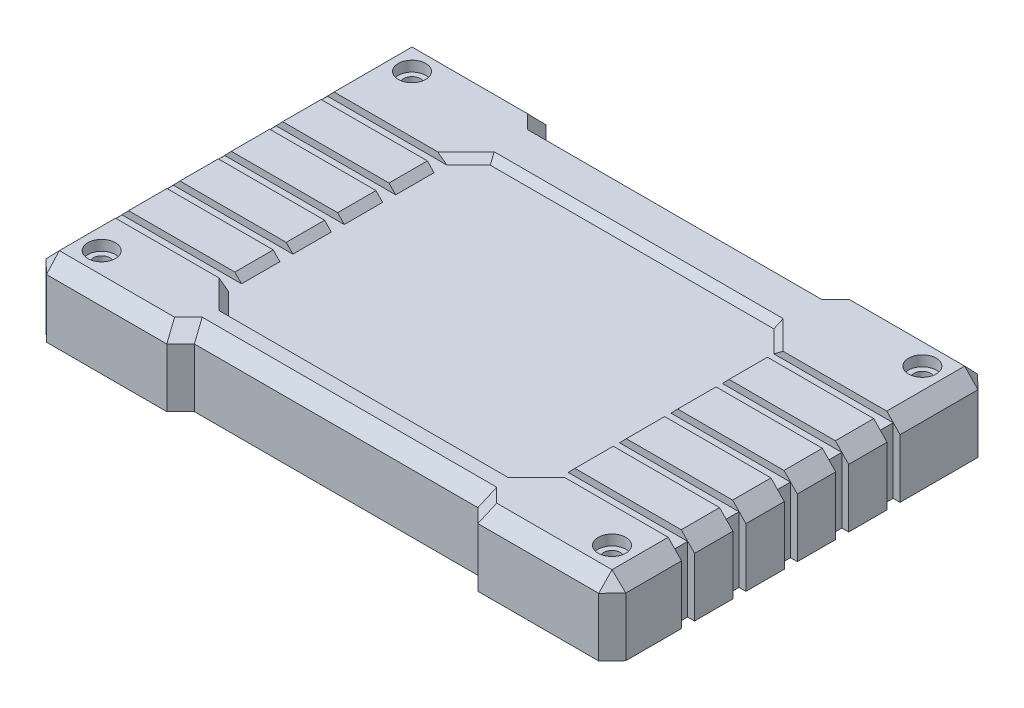
from build123d import *
from OCP.BRepFilletAPI import BRepFilletAPI_MakeChamfer

# Parameters (mm, degrees)
SKETCH_1_W          = 74
SKETCH_1_H          = 45
EXTRUDE_1_DEPTH     = 2
SKETCH_2_W          = 45
SKETCH_2_H          = 9.5
EXTRUDE_2_DEPTH     = 4
SKETCH_3_W          = 45
SKETCH_3_H          = 9.5
EXTRUDE_3_DEPTH     = 4
SKETCH_4_W          = 82
SKETCH_4_H          = 9.5
EXTRUDE_4_DEPTH     = 3
SKETCH_5_W          = 82
SKETCH_5_H          = 9.5
EXTRUDE_5_DEPTH     = 3
EXTRUDE_11_DEPTH    = 7.5
SKETCH_15_R         = 1.2
CUT_EXTRUDE_1_DEPTH = 50.208739061
SKETCH_16_R         = 2
SKETCH_16_R_2       = 0.9
EXTRUDE_12_DEPTH    = 4
SKETCH_17_W         = 5.562046036
SKETCH_17_H         = 9.5
SKETCH_17_W_2       = 11.231023018
SKETCH_17_W_3       = 8.081023018
EXTRUDE_13_DEPTH    = 1
SKETCH_18_W         = 5.562046036
SKETCH_18_H         = 9.5
SKETCH_18_W_2       = 11.231023018
SKETCH_18_W_3       = 8.081023018
EXTRUDE_14_DEPTH    = 1
EXTRUDE_15_DEPTH    = 9.5
SKETCH_20_W         = 18.311590736
SKETCH_20_H         = 5.562046036
EXTRUDE_16_DEPTH    = 1
CHAMFER_1_SIZE      = 2
CHAMFER_1_SIZE2     = 1.93137755
CHAMFER_2_SIZE      = 0.965688775
CHAMFER_2_SIZE_2    = 1
SKETCH_22_R         = 1.6
CUT_EXTRUDE_3_DEPTH = 5
CUT_EXTRUDE_4_REACH = 85.985
SKETCH_25_R         = 1.2
CUT_EXTRUDE_5_DEPTH = 52.093052365
SKETCH_26_R         = 2
CUT_EXTRUDE_6_DEPTH = 1.5
CUT_EXTRUDE_7_DEPTH = 2.5
CHAMFER_3_SIZE      = 1


with BuildPart() as part:
    # Эскиз1 → Бобышка-Вытянуть1 (new body)
    with BuildSketch(Plane(origin=(0, 0, 0), x_dir=(1, 0, 0), z_dir=(0, 1, 0))):
        Rectangle(SKETCH_1_W, SKETCH_1_H)
    extrude(amount=EXTRUDE_1_DEPTH)

    # Эскиз2 → Бобышка-Вытянуть2 (add)
    with BuildSketch(Plane.ZY.offset(37)):
        with Locations((0, -2.75)):
            Rectangle(SKETCH_2_W, SKETCH_2_H)
    extrude(amount=EXTRUDE_2_DEPTH)

    # Эскиз3 → Бобышка-Вытянуть3 (add)
    with BuildSketch(Plane(origin=(37, 0, 0), x_dir=(0, 0, -1), z_dir=(1, 0, 0))):
        with Locations((0, -2.75)):
            Rectangle(SKETCH_3_W, SKETCH_3_H)
    extrude(amount=EXTRUDE_3_DEPTH)

    # Эскиз4 → Бобышка-Вытянуть4 (add)
    with BuildSketch(Plane(origin=(0, 0, -22.5), x_dir=(-1, 0, 0), z_dir=(0, 0, -1))):
        with Locations((0, -2.75)):
            Rectangle(SKETCH_4_W, SKETCH_4_H)
    extrude(amount=EXTRUDE_4_DEPTH)

    # Эскиз5 → Бобышка-Вытянуть5 (add)
    with BuildSketch(Plane.XY.offset(22.5)):
        with Locations((0, -2.75)):
            Rectangle(SKETCH_5_W, SKETCH_5_H)
    extrude(amount=EXTRUDE_5_DEPTH)

    # Эскиз13 → Бобышка-Вытянуть11 (add)
    with BuildSketch(Plane.XZ):
        with BuildLine():
            Line((-37, -19.5), (-37, -22.5))
            Line((-37, -22.5), (-34, -22.5))
            ThreePointArc((-34, -22.5), (-34.878679656, -20.378679656), (-37, -19.5))
        make_face()
        with BuildLine():
            Line((-37, 22.5), (-34, 22.5))
            ThreePointArc((-34, 22.5), (-34.878679656, 20.378679656), (-37, 19.5))
            Line((-37, 19.5), (-37, 22.5))
        make_face()
        with BuildLine():
            Line((37, -22.5), (34, -22.5))
            ThreePointArc((34, -22.5), (34.878679656, -20.378679656), (37, -19.5))
            Line((37, -19.5), (37, -22.5))
        make_face()
        with BuildLine():
            Line((37, 22.5), (34, 22.5))
            ThreePointArc((34, 22.5), (34.878679656, 20.378679656), (37, 19.5))
            Line((37, 19.5), (37, 22.5))
        make_face()
    extrude(amount=EXTRUDE_11_DEPTH)

    # Эскиз15 → Вырез-Вытянуть1 (cut, through all)
    with BuildSketch(Plane.XZ.offset(7.5)):
        with Locations(Location((-37, -22.5, 0), (0, 0, 270))):
            Circle(SKETCH_15_R)
        with Locations(Location((-37, 22.5, 0), (0, 0, 270))):
            Circle(SKETCH_15_R)
        with Locations(Location((37, -22.5, 0), (0, 0, 90))):
            Circle(SKETCH_15_R)
        with Locations(Location((37, 22.5, 0), (0, 0, 90))):
            Circle(SKETCH_15_R)
    extrude(amount=-CUT_EXTRUDE_1_DEPTH, mode=Mode.SUBTRACT)

    # Эскиз16 → Бобышка-Вытянуть12 (add)
    # profile 1 of 5: a face of its own
    with BuildSketch(Plane.XZ):
        with Locations(Location((-33, 18.5, 0), (0, 0, 270))):
            Circle(SKETCH_16_R)
        with Locations(Location((-33, 18.5, 0), (0, 0, 270))):
            Circle(SKETCH_16_R_2, mode=Mode.SUBTRACT)
    # profile 2 of 5: a face of its own
    with BuildSketch(Plane.XZ):
        with Locations(Location((33, 18.5, 0), (0, 0, 270))):
            Circle(SKETCH_16_R)
        with Locations(Location((33, 18.5, 0), (0, 0, 270))):
            Circle(SKETCH_16_R_2, mode=Mode.SUBTRACT)
    # profile 3 of 5: a face of its own
    with BuildSketch(Plane.XZ):
        with Locations(Location((33, -15, 0), (0, 0, 270))):
            Circle(SKETCH_16_R)
        with Locations(Location((33, -15, 0), (0, 0, 270))):
            Circle(SKETCH_16_R_2, mode=Mode.SUBTRACT)
    # profile 4 of 5: a face of its own
    with BuildSketch(Plane.XZ):
        with Locations(Location((7, -15, 0), (0, 0, 270))):
            Circle(SKETCH_16_R)
        with Locations(Location((7, -15, 0), (0, 0, 270))):
            Circle(SKETCH_16_R_2, mode=Mode.SUBTRACT)
    # profile 5 of 5: a face of its own
    with BuildSketch(Plane.XZ):
        with Locations(Location((-33, -1.5, 0), (0, 0, 270))):
            Circle(SKETCH_16_R)
        with Locations(Location((-33, -1.5, 0), (0, 0, 270))):
            Circle(SKETCH_16_R_2, mode=Mode.SUBTRACT)
    extrude(amount=EXTRUDE_12_DEPTH)

    # Эскиз17 → Бобышка-Вытянуть13 (add)
    with BuildSketch(Plane.ZY.offset(41)):
        with Locations((12.75, -2.75)):
            Rectangle(SKETCH_17_W, SKETCH_17_H)
        with Locations((-19.884488491, -2.75)):
            Rectangle(SKETCH_17_W_2, SKETCH_17_H)
        with Locations((5.3, -2.75)):
            Rectangle(SKETCH_17_W, SKETCH_17_H)
        with Locations((-2.15, -2.75)):
            Rectangle(SKETCH_17_W, SKETCH_17_H)
        with Locations((-9.6, -2.75)):
            Rectangle(SKETCH_17_W, SKETCH_17_H)
        with Locations((21.459488491, -2.75)):
            Rectangle(SKETCH_17_W_3, SKETCH_17_H)
    extrude(amount=EXTRUDE_13_DEPTH)

    # Эскиз18 → Бобышка-Вытянуть14 (add)
    with BuildSketch(Plane(origin=(41, 0, 0), x_dir=(0, 0, -1), z_dir=(1, 0, 0))):
        with Locations((-12.75, -2.75)):
            Rectangle(SKETCH_18_W, SKETCH_18_H)
        with Locations((19.884488491, -2.75)):
            Rectangle(SKETCH_18_W_2, SKETCH_18_H)
        with Locations((-5.3, -2.75)):
            Rectangle(SKETCH_18_W, SKETCH_18_H)
        with Locations((2.15, -2.75)):
            Rectangle(SKETCH_18_W, SKETCH_18_H)
        with Locations((9.6, -2.75)):
            Rectangle(SKETCH_18_W, SKETCH_18_H)
        with Locations((-21.459488491, -2.75)):
            Rectangle(SKETCH_18_W_3, SKETCH_18_H)
    extrude(amount=EXTRUDE_14_DEPTH)

    # Эскиз19 → Бобышка-Вытянуть15 (add)
    with BuildSketch(Plane(origin=(0, 2, 0), x_dir=(1, 0, 0), z_dir=(0, 1, 0))):
        Polygon((-42, 25.5), (-42, 27.5), (-22.553693123, 27.5), (-20.553693123, 25.5), align=None)
        Polygon((-42, -25.5), (-42, -27.5), (-22.553693123, -27.5), (-20.553693123, -25.5), align=None)
        Polygon((42, 25.5), (42, 27.5), (22.553693123, 27.5), (20.553693123, 25.5), align=None)
        Polygon((42, -25.5), (42, -27.5), (22.553693123, -27.5), (20.553693123, -25.5), align=None)
    extrude(amount=-EXTRUDE_15_DEPTH)

    # Эскиз20 → Бобышка-Вытянуть16 (add)
    with BuildSketch(Plane(origin=(0, 2, 0), x_dir=(1, 0, 0), z_dir=(0, 1, 0))):
        Polygon((-23.688409264, 14.268976982), (-20.553693123, 17.403693123), (20.553693123, 17.403693123), (23.688409264, 14.268976982), (41, 14.268976982), (42, 14.268976982), (42, 27.5), (22.553693123, 27.5), (20.553693123, 25.5), (-20.553693123, 25.5), (-22.553693123, 27.5), (-42, 27.5), (-42, 14.268976982), (-41, 14.268976982), align=None)
        Polygon((-20.553693123, -20.553693123), (-23.688409264, -17.418976982), (-41, -17.418976982), (-42, -17.418976982), (-42, -27.5), (-22.553693123, -27.5), (-20.553693123, -25.5), (20.553693123, -25.5), (22.553693123, -27.5), (42, -27.5), (42, -17.418976982), (41, -17.418976982), (23.688409264, -17.418976982), (20.553693123, -20.553693123), align=None)
        with Locations((-32.844204632, 9.6)):
            Rectangle(SKETCH_20_W, SKETCH_20_H)
        with Locations((-32.844204632, 2.15)):
            Rectangle(SKETCH_20_W, SKETCH_20_H)
        with Locations((-32.844204632, -5.3)):
            Rectangle(SKETCH_20_W, SKETCH_20_H)
        with Locations((-32.844204632, -12.75)):
            Rectangle(SKETCH_20_W, SKETCH_20_H)
        Polygon((23.688409264, 12.381023018), (42, 12.381023018), (42, 6.818976982), (41, 6.818976982), (23.688409264, 6.818976982), align=None)
        with Locations((32.844204632, 2.15)):
            Rectangle(SKETCH_20_W, SKETCH_20_H)
        with Locations((32.844204632, -5.3)):
            Rectangle(SKETCH_20_W, SKETCH_20_H)
        with Locations((32.844204632, -12.75)):
            Rectangle(SKETCH_20_W, SKETCH_20_H)
    extrude(amount=EXTRUDE_16_DEPTH)

    # Фаска1: one chamfer whose edges measure the first distance from different faces: ONE call of the kernel's chamfer builder (chamfer() names one face for all edges)
    chamfer_1_edges_1 = [part.edges().sort_by_distance(p)[0] for p in [
        (-42, -2.25, -27.5),
        (-42, 3, -20.884488491),
    ]]
    chamfer_1_side_1 = [part.faces().sort_by_distance(p)[0] for p in [
        (-42, -2.25, -20.884488491),
    ]]
    chamfer_1_edges_2 = [part.edges().sort_by_distance(p)[0] for p in [
        (-42, -2.25, 27.5),
        (-32.276846561, 3, 27.5),
    ]]
    chamfer_1_side_2 = [part.faces().sort_by_distance(p)[0] for p in [
        (-32.276846561, -2.25, 27.5),
    ]]
    chamfer_1_edges_3 = [part.edges().sort_by_distance(p)[0] for p in [
        (42, -2.25, -27.5),
        (32.276846561, 3, -27.5),
    ]]
    chamfer_1_side_3 = [part.faces().sort_by_distance(p)[0] for p in [
        (32.276846561, -2.25, -27.5),
    ]]
    chamfer_1_edges_4 = [part.edges().sort_by_distance(p)[0] for p in [
        (42, -2.25, 27.5),
        (42, 3, 22.459488491),
    ]]
    chamfer_1_side_4 = [part.faces().sort_by_distance(p)[0] for p in [
        (42, -2.25, 22.459488491),
    ]]
    chamfer_1_edges_5 = [part.edges().sort_by_distance(p)[0] for p in [
        (42, 3, -20.884488491),
    ]]
    chamfer_1_side_5 = [part.faces().sort_by_distance(p)[0] for p in [
        (42, -2.25, -20.884488491),
    ]]
    chamfer_1_edges_6 = [part.edges().sort_by_distance(p)[0] for p in [
        (21.553693123, 3, -26.5),
    ]]
    chamfer_1_side_6 = [part.faces().sort_by_distance(p)[0] for p in [
        (21.553693123, -2.25, -26.5),
    ]]
    chamfer_1_edges_7 = [part.edges().sort_by_distance(p)[0] for p in [
        (0, 3, -25.5),
    ]]
    chamfer_1_side_7 = [part.faces().sort_by_distance(p)[0] for p in [
        (0, -2.25, -25.5),
    ]]
    chamfer_1_edges_8 = [part.edges().sort_by_distance(p)[0] for p in [
        (-21.553693123, 3, -26.5),
    ]]
    chamfer_1_side_8 = [part.faces().sort_by_distance(p)[0] for p in [
        (-21.553693123, -2.25, -26.5),
    ]]
    chamfer_1_edges_9 = [part.edges().sort_by_distance(p)[0] for p in [
        (-32.276846561, 3, -27.5),
    ]]
    chamfer_1_side_9 = [part.faces().sort_by_distance(p)[0] for p in [
        (-32.276846561, -2.25, -27.5),
    ]]
    chamfer_1_edges_10 = [part.edges().sort_by_distance(p)[0] for p in [
        (42, 3, -9.6),
    ]]
    chamfer_1_side_10 = [part.faces().sort_by_distance(p)[0] for p in [
        (42, -2.25, -9.6),
    ]]
    chamfer_1_edges_11 = [part.edges().sort_by_distance(p)[0] for p in [
        (-42, 3, 22.459488491),
    ]]
    chamfer_1_side_11 = [part.faces().sort_by_distance(p)[0] for p in [
        (-42, -2.25, 22.459488491),
    ]]
    chamfer_1_edges_12 = [part.edges().sort_by_distance(p)[0] for p in [
        (-21.553693123, 3, 26.5),
    ]]
    chamfer_1_side_12 = [part.faces().sort_by_distance(p)[0] for p in [
        (-21.553693123, -2.25, 26.5),
    ]]
    chamfer_1_edges_13 = [part.edges().sort_by_distance(p)[0] for p in [
        (0, 3, 25.5),
    ]]
    chamfer_1_side_13 = [part.faces().sort_by_distance(p)[0] for p in [
        (0, -2.25, 25.5),
    ]]
    chamfer_1_edges_14 = [part.edges().sort_by_distance(p)[0] for p in [
        (21.553693123, 3, 26.5),
    ]]
    chamfer_1_side_14 = [part.faces().sort_by_distance(p)[0] for p in [
        (21.553693123, -2.25, 26.5),
    ]]
    chamfer_1_edges_15 = [part.edges().sort_by_distance(p)[0] for p in [
        (32.276846561, 3, 27.5),
    ]]
    chamfer_1_side_15 = [part.faces().sort_by_distance(p)[0] for p in [
        (32.276846561, -2.25, 27.5),
    ]]
    chamfer_1_edges_16 = [part.edges().sort_by_distance(p)[0] for p in [
        (-42, 3, -9.6),
    ]]
    chamfer_1_side_16 = [part.faces().sort_by_distance(p)[0] for p in [
        (-42, -2.25, -9.6),
    ]]
    chamfer_1_edges_17 = [part.edges().sort_by_distance(p)[0] for p in [
        (-42, 3, -2.15),
    ]]
    chamfer_1_side_17 = [part.faces().sort_by_distance(p)[0] for p in [
        (-42, -2.25, -2.15),
    ]]
    chamfer_1_edges_18 = [part.edges().sort_by_distance(p)[0] for p in [
        (-42, 3, 5.3),
    ]]
    chamfer_1_side_18 = [part.faces().sort_by_distance(p)[0] for p in [
        (-42, -2.25, 5.3),
    ]]
    chamfer_1_edges_19 = [part.edges().sort_by_distance(p)[0] for p in [
        (-42, 3, 12.75),
    ]]
    chamfer_1_side_19 = [part.faces().sort_by_distance(p)[0] for p in [
        (-42, -2.25, 12.75),
    ]]
    chamfer_1_edges_20 = [part.edges().sort_by_distance(p)[0] for p in [
        (42, 3, -2.15),
    ]]
    chamfer_1_side_20 = [part.faces().sort_by_distance(p)[0] for p in [
        (42, -2.25, -2.15),
    ]]
    chamfer_1_edges_21 = [part.edges().sort_by_distance(p)[0] for p in [
        (42, 3, 5.3),
    ]]
    chamfer_1_side_21 = [part.faces().sort_by_distance(p)[0] for p in [
        (42, -2.25, 5.3),
    ]]
    chamfer_1_edges_22 = [part.edges().sort_by_distance(p)[0] for p in [
        (42, 3, 12.75),
    ]]
    chamfer_1_side_22 = [part.faces().sort_by_distance(p)[0] for p in [
        (42, -2.25, 12.75),
    ]]
    chamfer_1 = BRepFilletAPI_MakeChamfer(part.part.solid().wrapped)
    for e in chamfer_1_edges_1:
        chamfer_1.Add(CHAMFER_1_SIZE, CHAMFER_1_SIZE2, e.wrapped, chamfer_1_side_1[0].wrapped)  # the first distance lies on this face
    for e in chamfer_1_edges_2:
        chamfer_1.Add(CHAMFER_1_SIZE, CHAMFER_1_SIZE2, e.wrapped, chamfer_1_side_2[0].wrapped)  # the first distance lies on this face
    for e in chamfer_1_edges_3:
        chamfer_1.Add(CHAMFER_1_SIZE, CHAMFER_1_SIZE2, e.wrapped, chamfer_1_side_3[0].wrapped)  # the first distance lies on this face
    for e in chamfer_1_edges_4:
        chamfer_1.Add(CHAMFER_1_SIZE, CHAMFER_1_SIZE2, e.wrapped, chamfer_1_side_4[0].wrapped)  # the first distance lies on this face
    for e in chamfer_1_edges_5:
        chamfer_1.Add(CHAMFER_1_SIZE, CHAMFER_1_SIZE2, e.wrapped, chamfer_1_side_5[0].wrapped)  # the first distance lies on this face
    for e in chamfer_1_edges_6:
        chamfer_1.Add(CHAMFER_1_SIZE, CHAMFER_1_SIZE2, e.wrapped, chamfer_1_side_6[0].wrapped)  # the first distance lies on this face
    for e in chamfer_1_edges_7:
        chamfer_1.Add(CHAMFER_1_SIZE, CHAMFER_1_SIZE2, e.wrapped, chamfer_1_side_7[0].wrapped)  # the first distance lies on this face
    for e in chamfer_1_edges_8:
        chamfer_1.Add(CHAMFER_1_SIZE, CHAMFER_1_SIZE2, e.wrapped, chamfer_1_side_8[0].wrapped)  # the first distance lies on this face
    for e in chamfer_1_edges_9:
        chamfer_1.Add(CHAMFER_1_SIZE, CHAMFER_1_SIZE2, e.wrapped, chamfer_1_side_9[0].wrapped)  # the first distance lies on this face
    for e in chamfer_1_edges_10:
        chamfer_1.Add(CHAMFER_1_SIZE, CHAMFER_1_SIZE2, e.wrapped, chamfer_1_side_10[0].wrapped)  # the first distance lies on this face
    for e in chamfer_1_edges_11:
        chamfer_1.Add(CHAMFER_1_SIZE, CHAMFER_1_SIZE2, e.wrapped, chamfer_1_side_11[0].wrapped)  # the first distance lies on this face
    for e in chamfer_1_edges_12:
        chamfer_1.Add(CHAMFER_1_SIZE, CHAMFER_1_SIZE2, e.wrapped, chamfer_1_side_12[0].wrapped)  # the first distance lies on this face
    for e in chamfer_1_edges_13:
        chamfer_1.Add(CHAMFER_1_SIZE, CHAMFER_1_SIZE2, e.wrapped, chamfer_1_side_13[0].wrapped)  # the first distance lies on this face
    for e in chamfer_1_edges_14:
        chamfer_1.Add(CHAMFER_1_SIZE, CHAMFER_1_SIZE2, e.wrapped, chamfer_1_side_14[0].wrapped)  # the first distance lies on this face
    for e in chamfer_1_edges_15:
        chamfer_1.Add(CHAMFER_1_SIZE, CHAMFER_1_SIZE2, e.wrapped, chamfer_1_side_15[0].wrapped)  # the first distance lies on this face
    for e in chamfer_1_edges_16:
        chamfer_1.Add(CHAMFER_1_SIZE, CHAMFER_1_SIZE2, e.wrapped, chamfer_1_side_16[0].wrapped)  # the first distance lies on this face
    for e in chamfer_1_edges_17:
        chamfer_1.Add(CHAMFER_1_SIZE, CHAMFER_1_SIZE2, e.wrapped, chamfer_1_side_17[0].wrapped)  # the first distance lies on this face
    for e in chamfer_1_edges_18:
        chamfer_1.Add(CHAMFER_1_SIZE, CHAMFER_1_SIZE2, e.wrapped, chamfer_1_side_18[0].wrapped)  # the first distance lies on this face
    for e in chamfer_1_edges_19:
        chamfer_1.Add(CHAMFER_1_SIZE, CHAMFER_1_SIZE2, e.wrapped, chamfer_1_side_19[0].wrapped)  # the first distance lies on this face
    for e in chamfer_1_edges_20:
        chamfer_1.Add(CHAMFER_1_SIZE, CHAMFER_1_SIZE2, e.wrapped, chamfer_1_side_20[0].wrapped)  # the first distance lies on this face
    for e in chamfer_1_edges_21:
        chamfer_1.Add(CHAMFER_1_SIZE, CHAMFER_1_SIZE2, e.wrapped, chamfer_1_side_21[0].wrapped)  # the first distance lies on this face
    for e in chamfer_1_edges_22:
        chamfer_1.Add(CHAMFER_1_SIZE, CHAMFER_1_SIZE2, e.wrapped, chamfer_1_side_22[0].wrapped)  # the first distance lies on this face
    add(Compound.cast(chamfer_1.Shape()), mode=Mode.REPLACE)

    # Фаска2
    chamfer_2_edges_1 = [part.edges().sort_by_distance(p)[0] for p in [
        (-23.688409264, 3, 12.75),
    ]]
    chamfer_2_side_1 = [part.faces().sort_by_distance(p)[0] for p in [
        (-23.70772304, 3, 12.75),
    ]]
    chamfer_2_edges_2 = [part.edges().sort_by_distance(p)[0] for p in [
        (-23.688409264, 3, 5.3),
    ]]
    chamfer_2_side_2 = [part.faces().sort_by_distance(p)[0] for p in [
        (-23.70772304, 3, 5.3),
    ]]
    chamfer_2_edges_3 = [part.edges().sort_by_distance(p)[0] for p in [
        (-23.688409264, 3, -2.15),
    ]]
    chamfer_2_side_3 = [part.faces().sort_by_distance(p)[0] for p in [
        (-23.70772304, 3, -2.15),
    ]]
    chamfer_2_edges_4 = [part.edges().sort_by_distance(p)[0] for p in [
        (-23.688409264, 3, -9.6),
    ]]
    chamfer_2_side_4 = [part.faces().sort_by_distance(p)[0] for p in [
        (-23.70772304, 3, -9.6),
    ]]
    chamfer_2_edges_5 = [part.edges().sort_by_distance(p)[0] for p in [
        (-22.121051194, 3, -15.836335052),
    ]]
    chamfer_2_side_5 = [part.faces().sort_by_distance(p)[0] for p in [
        (-22.134708095, 3, -15.849991954),
    ]]
    chamfer_2_edges_6 = [part.edges().sort_by_distance(p)[0] for p in [
        (0, 3, -17.403693123),
    ]]
    chamfer_2_side_6 = [part.faces().sort_by_distance(p)[0] for p in [
        (0, 3, -17.423006898),
    ]]
    chamfer_2_edges_7 = [part.edges().sort_by_distance(p)[0] for p in [
        (22.121051194, 3, -15.836335052),
    ]]
    chamfer_2_side_7 = [part.faces().sort_by_distance(p)[0] for p in [
        (22.134708095, 3, -15.849991954),
    ]]
    chamfer_2_edges_8 = [part.edges().sort_by_distance(p)[0] for p in [
        (23.688409264, 3, -9.6),
    ]]
    chamfer_2_side_8 = [part.faces().sort_by_distance(p)[0] for p in [
        (23.70772304, 3, -9.6),
    ]]
    chamfer_2_edges_9 = [part.edges().sort_by_distance(p)[0] for p in [
        (23.688409264, 3, -2.15),
    ]]
    chamfer_2_side_9 = [part.faces().sort_by_distance(p)[0] for p in [
        (23.70772304, 3, -2.15),
    ]]
    chamfer_2_edges_10 = [part.edges().sort_by_distance(p)[0] for p in [
        (23.688409264, 3, 5.3),
    ]]
    chamfer_2_side_10 = [part.faces().sort_by_distance(p)[0] for p in [
        (23.70772304, 3, 5.3),
    ]]
    chamfer_2_edges_11 = [part.edges().sort_by_distance(p)[0] for p in [
        (23.688409264, 3, 12.75),
    ]]
    chamfer_2_side_11 = [part.faces().sort_by_distance(p)[0] for p in [
        (23.70772304, 3, 12.75),
    ]]
    chamfer_2_edges_12 = [part.edges().sort_by_distance(p)[0] for p in [
        (-22.121051194, 3, 18.986335052),
    ]]
    chamfer_2_side_12 = [part.faces().sort_by_distance(p)[0] for p in [
        (-22.134708095, 3, 18.999991954),
    ]]
    chamfer_2_edges_13 = [part.edges().sort_by_distance(p)[0] for p in [
        (22.121051194, 3, 18.986335052),
    ]]
    chamfer_2_side_13 = [part.faces().sort_by_distance(p)[0] for p in [
        (22.134708095, 3, 18.999991954),
    ]]
    chamfer_2_edges_14 = [part.edges().sort_by_distance(p)[0] for p in [
        (0, 3, 20.553693123),
    ]]
    chamfer_2_side_14 = [part.faces().sort_by_distance(p)[0] for p in [
        (0, 3, 20.573006898),
    ]]
    chamfer_2 = BRepFilletAPI_MakeChamfer(part.part.solid().wrapped)
    for e in chamfer_2_edges_1:
        chamfer_2.Add(CHAMFER_2_SIZE - 0.0001, CHAMFER_2_SIZE_2 - 0.0001, e.wrapped, chamfer_2_side_1[0].wrapped)
    for e in chamfer_2_edges_2:
        chamfer_2.Add(CHAMFER_2_SIZE - 0.0001, CHAMFER_2_SIZE_2 - 0.0001, e.wrapped, chamfer_2_side_2[0].wrapped)
    for e in chamfer_2_edges_3:
        chamfer_2.Add(CHAMFER_2_SIZE - 0.0001, CHAMFER_2_SIZE_2 - 0.0001, e.wrapped, chamfer_2_side_3[0].wrapped)
    for e in chamfer_2_edges_4:
        chamfer_2.Add(CHAMFER_2_SIZE - 0.0001, CHAMFER_2_SIZE_2 - 0.0001, e.wrapped, chamfer_2_side_4[0].wrapped)
    for e in chamfer_2_edges_5:
        chamfer_2.Add(CHAMFER_2_SIZE - 0.0001, CHAMFER_2_SIZE_2 - 0.0001, e.wrapped, chamfer_2_side_5[0].wrapped)
    for e in chamfer_2_edges_6:
        chamfer_2.Add(CHAMFER_2_SIZE - 0.0001, CHAMFER_2_SIZE_2 - 0.0001, e.wrapped, chamfer_2_side_6[0].wrapped)
    for e in chamfer_2_edges_7:
        chamfer_2.Add(CHAMFER_2_SIZE - 0.0001, CHAMFER_2_SIZE_2 - 0.0001, e.wrapped, chamfer_2_side_7[0].wrapped)
    for e in chamfer_2_edges_8:
        chamfer_2.Add(CHAMFER_2_SIZE - 0.0001, CHAMFER_2_SIZE_2 - 0.0001, e.wrapped, chamfer_2_side_8[0].wrapped)
    for e in chamfer_2_edges_9:
        chamfer_2.Add(CHAMFER_2_SIZE - 0.0001, CHAMFER_2_SIZE_2 - 0.0001, e.wrapped, chamfer_2_side_9[0].wrapped)
    for e in chamfer_2_edges_10:
        chamfer_2.Add(CHAMFER_2_SIZE - 0.0001, CHAMFER_2_SIZE_2 - 0.0001, e.wrapped, chamfer_2_side_10[0].wrapped)
    for e in chamfer_2_edges_11:
        chamfer_2.Add(CHAMFER_2_SIZE - 0.0001, CHAMFER_2_SIZE_2 - 0.0001, e.wrapped, chamfer_2_side_11[0].wrapped)
    for e in chamfer_2_edges_12:
        chamfer_2.Add(CHAMFER_2_SIZE - 0.0001, CHAMFER_2_SIZE_2 - 0.0001, e.wrapped, chamfer_2_side_12[0].wrapped)
    for e in chamfer_2_edges_13:
        chamfer_2.Add(CHAMFER_2_SIZE - 0.0001, CHAMFER_2_SIZE_2 - 0.0001, e.wrapped, chamfer_2_side_13[0].wrapped)
    for e in chamfer_2_edges_14:
        chamfer_2.Add(CHAMFER_2_SIZE - 0.0001, CHAMFER_2_SIZE_2 - 0.0001, e.wrapped, chamfer_2_side_14[0].wrapped)
    add(Compound.cast(chamfer_2.Shape()), mode=Mode.REPLACE)  # a hair under: the kernel refuses the full size

    # Эскиз22 → Вырез-Вытянуть3 (cut)
    with BuildSketch(Plane(origin=(-37, 0, 0), x_dir=(0, 0, -1), z_dir=(1, 0, 0))):
        with Locations((-13.4, -7.5)):
            Circle(SKETCH_22_R)
    extrude(amount=-CUT_EXTRUDE_3_DEPTH, mode=Mode.SUBTRACT)

    # Вырез-Вытянуть4: up to this face of the body (flat: up to its plane)
    cut_extrude_4_end = Plane(part.part.faces().sort_by_distance((-42, -3.25, 5.3))[0])
    # Эскиз23 → Вырез-Вытянуть4 (cut, up to the picked face)
    with BuildSketch(Plane(origin=(-37, 0, 0), x_dir=(0, 0, -1), z_dir=(1, 0, 0)), mode=Mode.PRIVATE) as cut_extrude_4_sk1:
        Polygon((-2.27, -7.5), (-2.27, -6.408578644), (-3.578578644, -5.1), (-9.161421356, -5.1), (-10.47, -6.408578644), (-10.47, -7.5), align=None)
    cut_extrude_4_tool1 = split(extrude(cut_extrude_4_sk1.sketch, amount=-CUT_EXTRUDE_4_REACH, mode=Mode.PRIVATE), bisect_by=cut_extrude_4_end, keep=Keep.BOTH, mode=Mode.PRIVATE)
    add(cut_extrude_4_tool1.solids().sort_by(Axis((-37, -6.372794, 6.37), (-1, 0, 0)))[0], mode=Mode.SUBTRACT)

    # Эскиз25 → Вырез-Вытянуть5 (cut, through all)
    with BuildSketch(Plane.XZ.offset(-2)):
        with Locations(Location((-37, 22.5, 0), (0, 0, 270))):
            Circle(SKETCH_25_R)
        with Locations(Location((-37, -22.5, 0), (0, 0, 270))):
            Circle(SKETCH_25_R)
        with Locations(Location((37, 22.5, 0), (0, 0, 270))):
            Circle(SKETCH_25_R)
        with Locations(Location((37, -22.5, 0), (0, 0, 270))):
            Circle(SKETCH_25_R)
    extrude(amount=-CUT_EXTRUDE_5_DEPTH, mode=Mode.SUBTRACT)

    # Эскиз26 → Вырез-Вытянуть6 (cut)
    with BuildSketch(Plane(origin=(0, 3, 0), x_dir=(1, 0, 0), z_dir=(0, 1, 0))):
        with Locations(Location((-37, 22.5, 0), (0, 0, 270))):
            Circle(SKETCH_26_R)
        with Locations(Location((-37, -22.5, 0), (0, 0, 270))):
            Circle(SKETCH_26_R)
        with Locations(Location((37, 22.5, 0), (0, 0, 270))):
            Circle(SKETCH_26_R)
        with Locations(Location((37, -22.5, 0), (0, 0, 270))):
            Circle(SKETCH_26_R)
    extrude(amount=-CUT_EXTRUDE_6_DEPTH, mode=Mode.SUBTRACT)

    # Эскиз28 → Вырез-Вытянуть7 (cut)
    with BuildSketch(Plane.ZY.offset(42)):
        Polygon((0.631023018, -7.5), (0.631023018, -4.2), (1.631023018, -3.2), (16.418976982, -3.2), (17.418976982, -4.2), (17.418976982, -7.5), align=None)
    extrude(amount=-CUT_EXTRUDE_7_DEPTH, mode=Mode.SUBTRACT)

    # Фаска3
    chamfer_3_edges = [part.edges().sort_by_distance(p)[0] for p in [
        (-42, -3.2, 12.75),
        (-42, -3.2, 5.3),
    ]]
    chamfer(chamfer_3_edges, length=CHAMFER_3_SIZE)


solid = part.part
